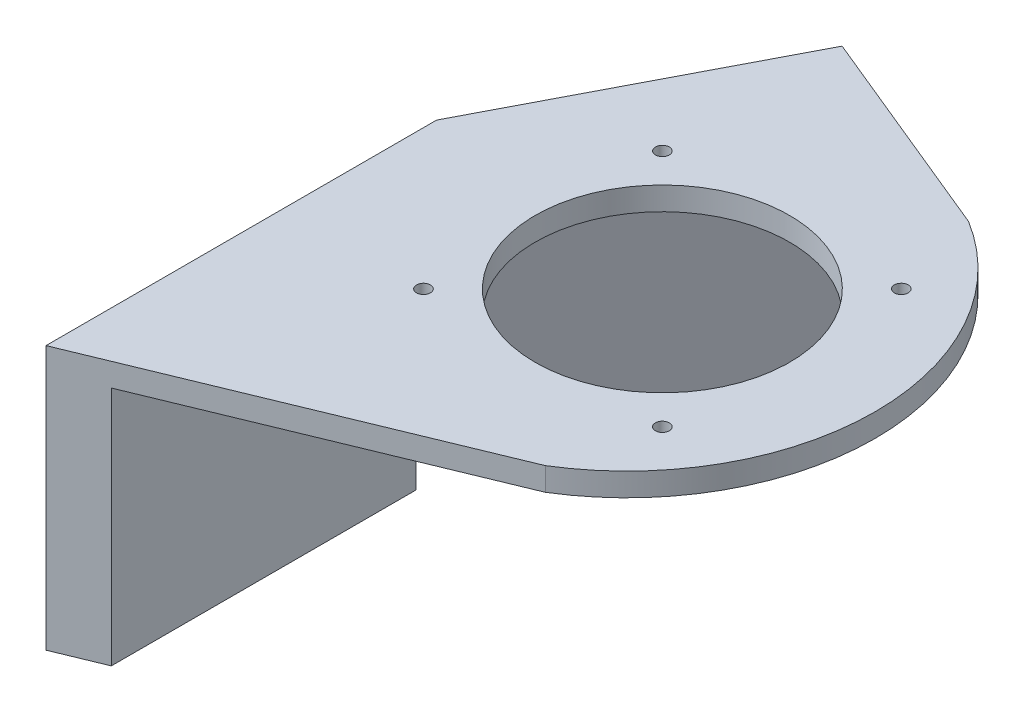
from build123d import *

# Parameters (mm, degrees)
SKETCH2_R           = 13.75
SKETCH2_R_2         = 0.75
BOSS_EXTRUDE1_DEPTH = 2.5
BOSS_EXTRUDE2_DEPTH = 26
SKETCH5_W           = 7.2
SKETCH5_H           = 21
BOSS_EXTRUDE5_DEPTH = 5


with BuildPart() as part:
    # Sketch2 → Boss-Extrude1 (new body)
    with BuildSketch(Plane(origin=(0, 0, 0), x_dir=(1, 0, 0), z_dir=(0, 1, 0))):
        with BuildLine():
            Line((104.5, -77.2), (142.702591635, -61.456260882))
            ThreePointArc((142.702591635, -61.456260882), (155.480653983, -38.6), (142.702591635, -15.743739118))
            Line((142.702591635, -15.743739118), (119.48341621, -6.174842748))
            Line((119.48341621, -6.174842748), (104.5, -35))
            Line((104.5, -35), (104.5, -77.2))
        make_face()
        with Locations((132.490326991, -38.6)):
            Circle(SKETCH2_R, mode=Mode.SUBTRACT)
        with Locations((145.395025748, -25.695301243)):
            Circle(SKETCH2_R_2, mode=Mode.SUBTRACT)
        with Locations((119.585628235, -51.504698757)):
            Circle(SKETCH2_R_2, mode=Mode.SUBTRACT)
        with Locations((119.585628235, -25.695301243)):
            Circle(SKETCH2_R_2, mode=Mode.SUBTRACT)
        with Locations((145.395025748, -51.504698757)):
            Circle(SKETCH2_R_2, mode=Mode.SUBTRACT)
    extrude(amount=BOSS_EXTRUDE1_DEPTH)

    # Sketch3 → Boss-Extrude2 (add)
    with BuildSketch(Plane.XZ):
        Polygon((104.5, 42.2), (109.5, 42.2), (109.5, 75.139440959), (104.5, 77.2), align=None)
        Polygon((109.5, 35), (104.5, 35), (119.48341621, 6.174842748), (123.601295817, 7.871869559), align=None)
    extrude(amount=BOSS_EXTRUDE2_DEPTH)

    # Sketch5 → Boss-Extrude5 (add)
    with BuildSketch(Plane.ZY.offset(-104.5)):
        with Locations((38.6, -10.5)):
            Rectangle(SKETCH5_W, SKETCH5_H)
    extrude(amount=-BOSS_EXTRUDE5_DEPTH)


solid = part.part
